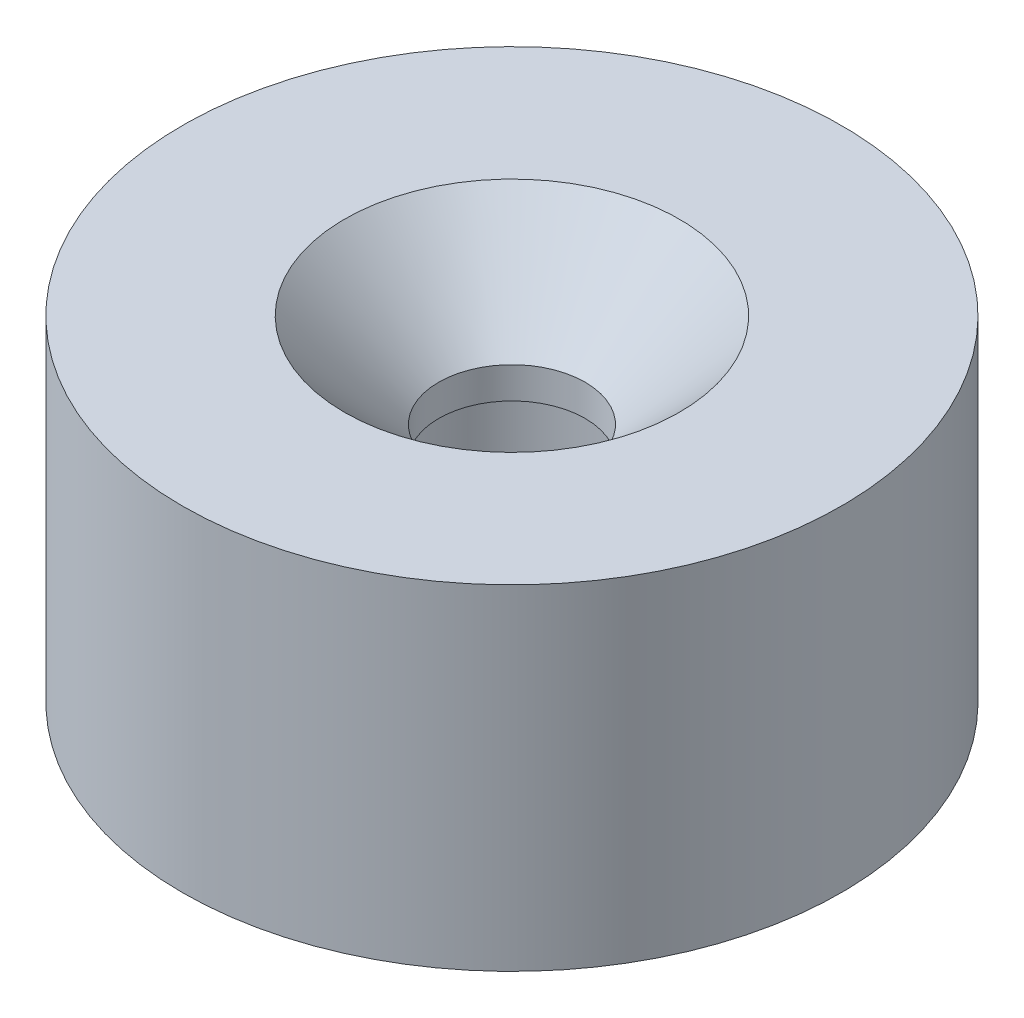
from build123d import *

# Parameters (mm, degrees)
SKETCH1_R           = 7.875
SKETCH1_R_2         = 1.75
BOSS_EXTRUDE1_DEPTH = 8
SKETCH2_R           = 4
CUT_EXTRUDE1_DEPTH  = 3
CUT_EXTRUDE1_DRAFT  = -45
SKETCH3_R           = 4
CUT_EXTRUDE2_DEPTH  = 5
BOSS_EXTRUDE2_START = 2
SKETCH4_R           = 4
SKETCH4_R_2         = 2.5
BOSS_EXTRUDE2_DEPTH = 2


with BuildPart() as part:
    # Sketch1 → Boss-Extrude1 (new body)
    with BuildSketch(Plane(origin=(0, 0, 0), x_dir=(1, 0, 0), z_dir=(0, 1, 0))):
        Circle(SKETCH1_R)
        Circle(SKETCH1_R_2, mode=Mode.SUBTRACT)
    extrude(amount=BOSS_EXTRUDE1_DEPTH)


with BuildPart() as cut_extrude1_tool:
    # Sketch2 → Cut-Extrude1 (with draft: the straight prism first)
    with BuildSketch(Plane(origin=(0, 8, 0), x_dir=(1, 0, 0), z_dir=(0, 1, 0))):
        Circle(SKETCH2_R)
    extrude(amount=-CUT_EXTRUDE1_DEPTH)
    # Cut-Extrude1: the draft: its side faces are tilted about the plane it starts from
    cut_extrude1_sides = [cut_extrude1_tool.faces().sort_by_distance(p)[0] for p in [
        (-4, 6.5, 0),
    ]]
    draft(cut_extrude1_sides, Plane(origin=(0, 8, 0), x_dir=(1, 0, 0), z_dir=(0, 1, 0)), CUT_EXTRUDE1_DRAFT)


with BuildPart() as part_1:
    add(part.part)

    # Cut-Extrude1: cut by cut_extrude1_tool
    add(cut_extrude1_tool.part, mode=Mode.SUBTRACT)

    # Sketch3 → Cut-Extrude2 (cut)
    with BuildSketch(Plane(origin=(0, 0, 0), x_dir=(-1, 0, 0), z_dir=(0, -1, 0))):
        Circle(SKETCH3_R)
    extrude(amount=-CUT_EXTRUDE2_DEPTH, mode=Mode.SUBTRACT)

    # Sketch4 → Boss-Extrude2 (add)
    with BuildSketch(Plane.XZ.offset(-5).offset(BOSS_EXTRUDE2_START)):
        Circle(SKETCH4_R)
        Circle(SKETCH4_R_2, mode=Mode.SUBTRACT)
    extrude(amount=-BOSS_EXTRUDE2_DEPTH)


solid = part_1.part
